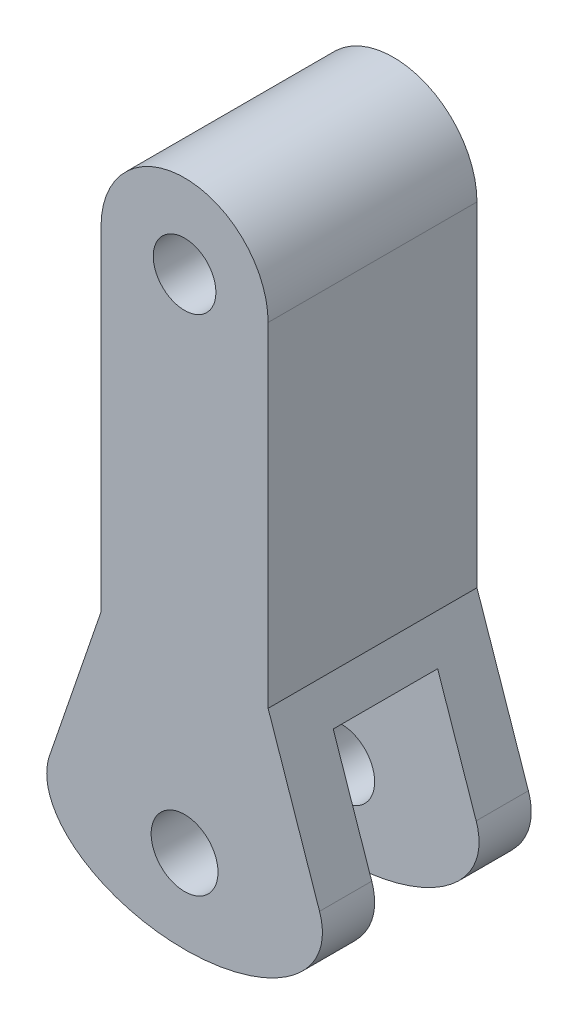
from build123d import *

# Parameters (mm, degrees)
EXTRUDE_1_DEPTH          = 50
CUT_EXTRUDE_1_DEPTH      = 158.825853549
CUT_EXTRUDE_1_DEPTH_BACK = 158.825853549
SKETCH_2_W               = 25
SKETCH_2_H               = 61.470122714
CUT_EXTRUDE_2_DEPTH      = 153.279348713
CUT_EXTRUDE_2_DEPTH_BACK = 153.279348713
SKETCH_3_OUTSIDE_W       = 104.032
SKETCH_3_OUTSIDE_H       = 198.032
SKETCH_3_OUTSIDE_R       = 8
SKETCH_4_R               = 7.5
CUT_EXTRUDE_3_DEPTH      = 153.279348713


with BuildPart() as part:
    # 草图1 → 凸台-拉伸1 (new body)
    with BuildSketch(Plane.XY):
        with BuildLine():
            Line((-20, -80), (-32.310858712, -115.934042004))
            add(Edge.make_bspline(
                [(-32.310858712, -115.934042004), (-33, -117.945569596), (-33, -120)],
                knots=[6.078460318, 6.078460318, 6.078460318, 6.283185307, 6.283185307, 6.283185307], degree=2, weights=[1, 0.994765533, 1]))
            add(Edge.make_bspline(
                [(-33, -120), (-33, -139.99999992), (-1.32e-07, -140)],
                knots=[0, 0, 0, 1.570796323, 1.570796323, 1.570796323], degree=2, weights=[1, 0.707106783, 1]))
            add(Edge.make_bspline(
                [(-1.32e-07, -140), (40.555759462, -140.000000098), (32.310858712, -115.934042004)],
                knots=[1.570796323, 1.570796323, 1.570796323, 3.346317643, 3.346317643, 3.346317643], degree=2, weights=[1, 0.631150575, 1]))
            Line((32.310858712, -115.934042004), (20, -80))
            Line((20, -80), (20, 0))
            ThreePointArc((20, 0), (0, 20), (-20, 0))
            Line((-20, 0), (-20, -80))
        make_face()
    extrude(amount=EXTRUDE_1_DEPTH)

    # 草图2 → 切除-拉伸1 (cut, two sides: drawn at the far end of the back side and taken through both)
    with BuildSketch(Plane(origin=(20, 0, 0), x_dir=(0, 0, -1), z_dir=(1, 0, 0)).offset(-CUT_EXTRUDE_1_DEPTH_BACK)):
        with Locations((-25, -119.735061357)):
            Rectangle(SKETCH_2_W, SKETCH_2_H)
    extrude(amount=CUT_EXTRUDE_1_DEPTH + CUT_EXTRUDE_1_DEPTH_BACK, mode=Mode.SUBTRACT)

    # 草图3 outside → 切除-拉伸2 (cut, two sides: drawn at the far end of the back side and taken through both)
    # profile 1 of 2: a face of its own
    with BuildSketch(Plane.XY.offset(50).offset(-CUT_EXTRUDE_2_DEPTH_BACK)):
        with Locations((0, -60)):
            Rectangle(SKETCH_3_OUTSIDE_W, SKETCH_3_OUTSIDE_H)
        with BuildLine():
            Line((32.310858712, -115.934042004), (20, -80))
            Line((20, -80), (20, 0))
            ThreePointArc((20, 0), (0, 20), (-20, 0))
            Line((-20, 0), (-20, -80))
            Line((-20, -80), (-32.310858712, -115.934042004))
            add(Edge.make_bspline(
                [(-32.310858712, -115.934042004), (-40.555759429, -140), (0, -140), (40.555759429, -140), (32.310858712, -115.934042004)],
                knots=[6.078460318, 6.078460318, 6.078460318, 7.853981634, 7.853981634, 9.62950295, 9.62950295, 9.62950295], degree=2, weights=[1, 0.631150576, 1, 0.631150576, 1]))
        make_face(mode=Mode.SUBTRACT)
    # profile 2 of 2: a face of its own
    with BuildSketch(Plane.XY.offset(50).offset(-CUT_EXTRUDE_2_DEPTH_BACK)):
        with Locations((0, -120)):
            Circle(SKETCH_3_OUTSIDE_R)
    extrude(amount=CUT_EXTRUDE_2_DEPTH + CUT_EXTRUDE_2_DEPTH_BACK, mode=Mode.SUBTRACT)

    # 草图4 → 切除-拉伸3 (cut, through all)
    with BuildSketch(Plane.XY.offset(50)):
        Circle(SKETCH_4_R)
    extrude(amount=-CUT_EXTRUDE_3_DEPTH, mode=Mode.SUBTRACT)


solid = part.part
